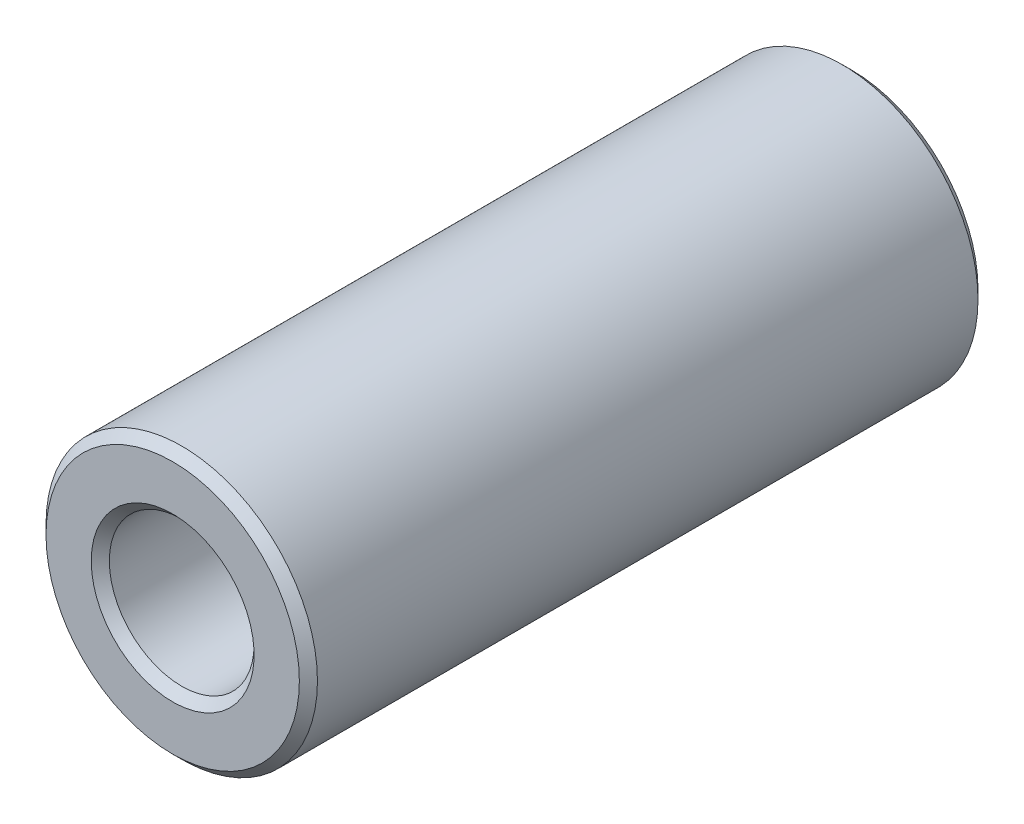
from build123d import *

# Parameters (mm, degrees)
SKETCH_1_W     = 15
SKETCH_1_H     = 1.4
CHAMFER_1_SIZE = 0.2


with BuildPart() as part:
    # ｽｹｯﾁ1 → 回転1 (revolve)
    with BuildSketch(Plane(origin=(0, 0, 0), x_dir=(0, 0, -1), z_dir=(1, 0, 0))):
        with Locations((0, 2.3)):
            Rectangle(SKETCH_1_W, SKETCH_1_H)
    revolve(axis=Axis((0, 0, 7.128099174), (0, 0, -1)))

    # 面取り1
    chamfer_1_edges = [part.edges().sort_by_distance(p)[0] for p in [
        (0, -1.6, 7.5),
        (0, -1.6, -7.5),
        (0, -3, -7.5),
        (0, -3, 7.5),
    ]]
    chamfer(chamfer_1_edges, length=CHAMFER_1_SIZE)


solid = part.part
